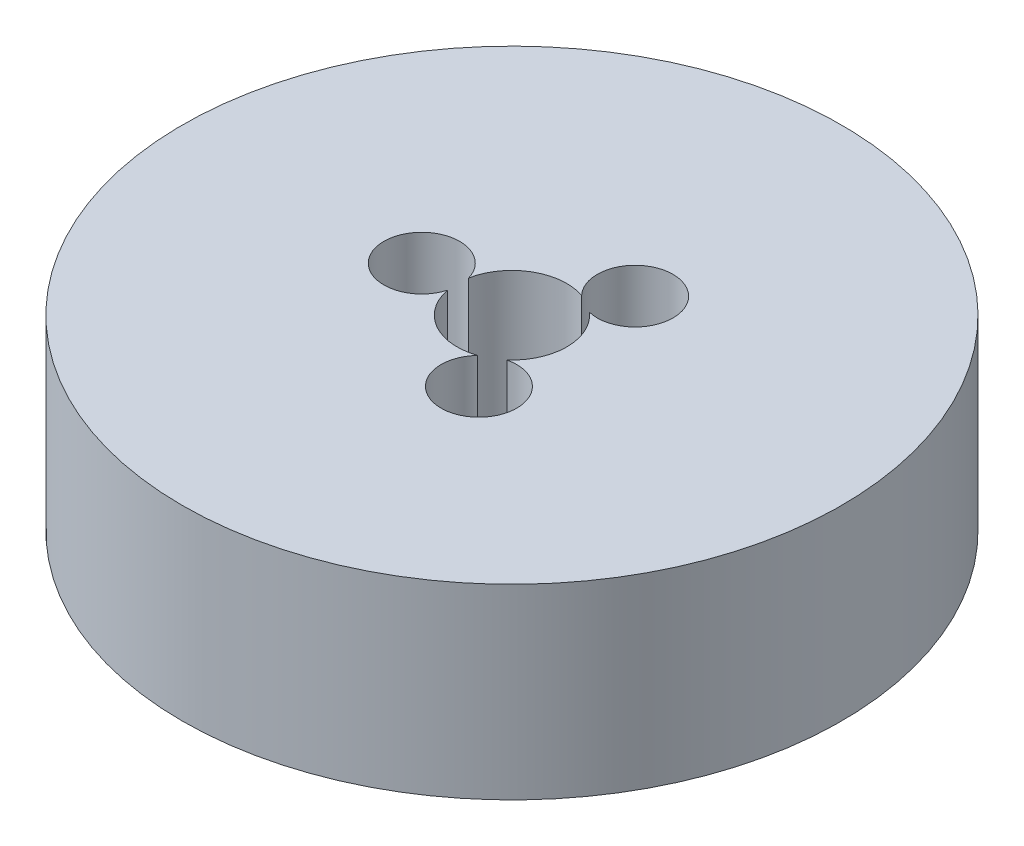
from build123d import *

# Parameters (mm, degrees)
SKETCH1_R           = 30
BOSS_EXTRUDE1_DEPTH = 17
SKETCH2_R           = 5
CUT_EXTRUDE1_DEPTH  = 46.705579528
SKETCH3_R           = 3.445082947
CUT_EXTRUDE2_DEPTH  = 12.042134378
CIRPATTERN1_COUNT   = 3


with BuildPart() as part:
    # Sketch1 → Boss-Extrude1 (new body)
    with BuildSketch(Plane(origin=(0, 0, 0), x_dir=(1, 0, 0), z_dir=(0, 1, 0))):
        Circle(SKETCH1_R)
    extrude(amount=BOSS_EXTRUDE1_DEPTH)

    # Sketch2 → Cut-Extrude1 (cut, through all)
    with BuildSketch(Plane(origin=(0, 0, 0), x_dir=(1, 0, 0), z_dir=(0, 1, 0))):
        Circle(SKETCH2_R)
    extrude(amount=CUT_EXTRUDE1_DEPTH, mode=Mode.SUBTRACT)

    # Sketch3 → Cut-Extrude2 (cut)
    with BuildSketch(Plane(origin=(0, 17, 0), x_dir=(1, 0, 0), z_dir=(0, 1, 0))):
        with Locations((-8.210005164, 0)):
            Circle(SKETCH3_R)
    cut_extrude2 = extrude(amount=-CUT_EXTRUDE2_DEPTH, mode=Mode.SUBTRACT)

    # CirPattern1: Cut-Extrude2 ×3 about axis
    cirpattern1_axis = Axis((0, 0, 0), (0, 1, 0))
    for i in range(1, CIRPATTERN1_COUNT):
        add(cut_extrude2.rotate(cirpattern1_axis, i * 360 / CIRPATTERN1_COUNT), mode=Mode.SUBTRACT)


solid = part.part
